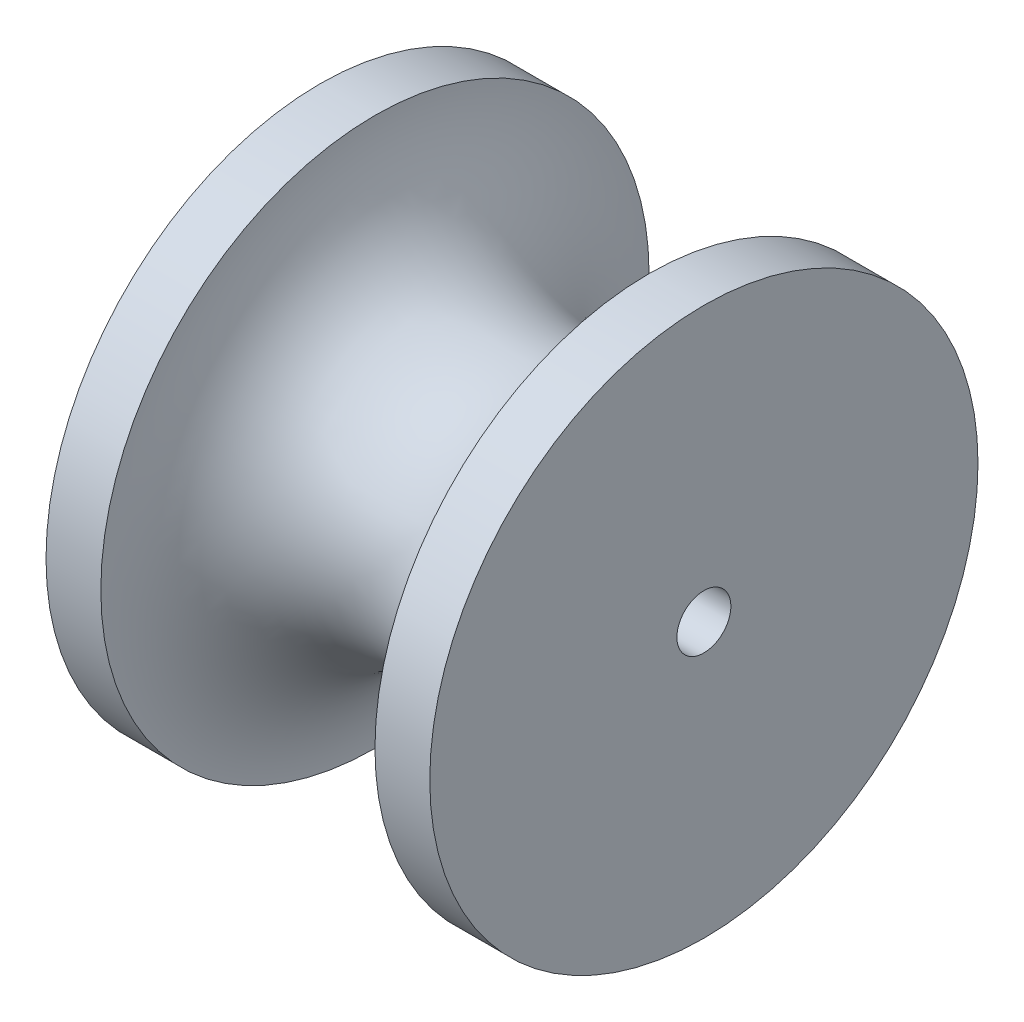
from build123d import *

# Parameters (mm, degrees)
SKETCH5_R          = 2.5
CUT_EXTRUDE2_DEPTH = 35.56


with BuildPart() as part:
    # Sketch1 → Revolve1 (revolve)
    with BuildSketch(Plane.XY):
        with BuildLine():
            Line((-35.56, 0), (-30.48, 0))
            ThreePointArc((-30.48, 0), (-17.78, -12.7), (-5.08, 0))
            Line((-5.08, 0), (0, 0))
            Line((0, 0), (0, -25.4))
            Line((0, -25.4), (-35.56, -25.4))
            Line((-35.56, -25.4), (-35.56, 0))
        make_face()
    revolve(axis=Axis((-35.56, -25.4, 0), (1, 0, 0)))

    # Sketch5 → Cut-Extrude2 (cut)
    with BuildSketch(Plane.ZY.offset(35.56)):
        with Locations((0, -25.4)):
            Circle(SKETCH5_R)
    extrude(amount=-CUT_EXTRUDE2_DEPTH, mode=Mode.SUBTRACT)


solid = part.part
